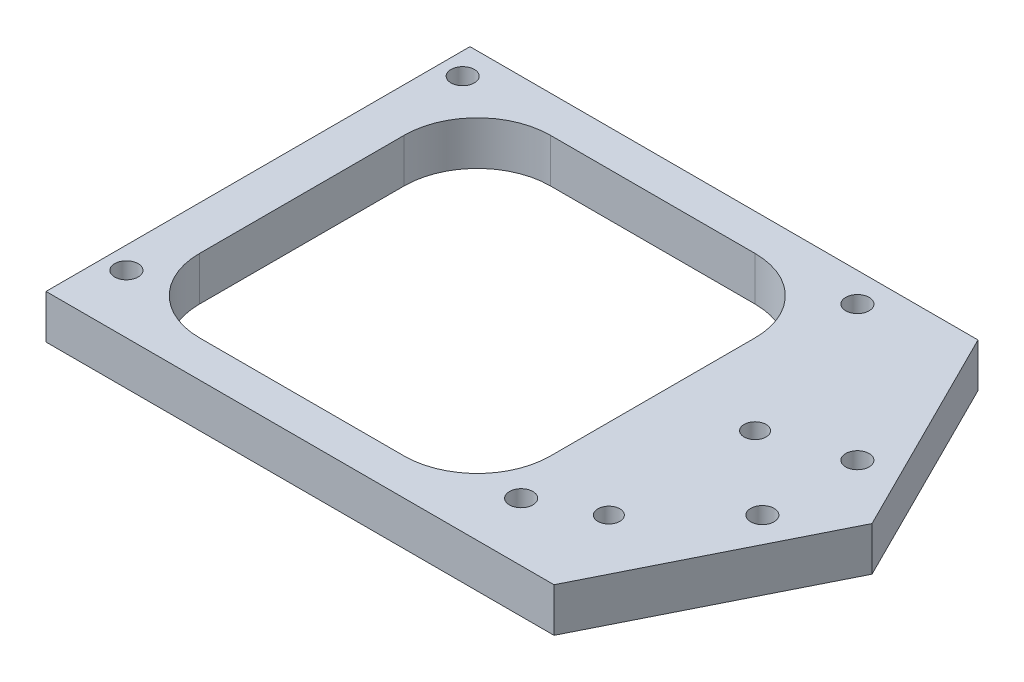
from build123d import *

# Parameters (mm, degrees)
BOSS_EXTRUDE1_DEPTH     = 1.5
CUT_EXTRUDE1_DEPTH      = 52.061237744
CUT_EXTRUDE1_DEPTH_BACK = 52.061237744
SKETCH2_W               = 24
SKETCH2_H               = 24
FILLET1_R               = 5
M2X0_4_TAPPED_HOLE1_D   = 1.6
F_1_5MM_DOWEL_HOLE1_D   = 1.5


with BuildPart() as part:
    # Sketch1 → Boss-Extrude1 (new, symmetric)
    with BuildSketch(Plane(origin=(0, 0, 0), x_dir=(1, 0, 0), z_dir=(0, 1, 0))):
        Polygon((0, 0), (34.748434417, 0), (42, 14.5), (34.748434417, 29), (0, 29), align=None)
    extrude(amount=BOSS_EXTRUDE1_DEPTH, both=True)

    # Sketch2 → Cut-Extrude1 (cut, two sides: drawn at the far end of the back side and taken through both)
    with BuildSketch(Plane(origin=(0, 0, 0), x_dir=(1, 0, 0), z_dir=(0, 1, 0)).offset(-CUT_EXTRUDE1_DEPTH_BACK)):
        with Locations((15, 14.5)):
            Rectangle(SKETCH2_W, SKETCH2_H)
    extrude(amount=CUT_EXTRUDE1_DEPTH + CUT_EXTRUDE1_DEPTH_BACK, mode=Mode.SUBTRACT)

    # Fillet1
    fillet1_edges = [part.edges().sort_by_distance(p)[0] for p in [
        (3, 0, -26.5),
        (27, 0, -26.5),
        (27, 0, -2.5),
        (3, 0, -2.5),
    ]]
    fillet(fillet1_edges, radius=FILLET1_R)

    # M2x0.4 Tapped Hole1 (through all)
    with Locations(Plane(origin=(1.5, 1.5, -27), x_dir=(0, 0, 1), z_dir=(0, 1, 0))):
        with Locations((0, 0), (0, 27), (9.25, 36.248434417), (15.75, 36.248434417), (23, 27), (23, 0)):
            Hole(M2X0_4_TAPPED_HOLE1_D / 2)

    # Ø1.5mm Dowel Hole1 (through all)
    with Locations(Plane(origin=(32.5, 1.5, -16), x_dir=(0, 0, 1), z_dir=(0, 1, 0))):
        with Locations((0, 0), (10, 0)):
            Hole(F_1_5MM_DOWEL_HOLE1_D / 2)


solid = part.part
